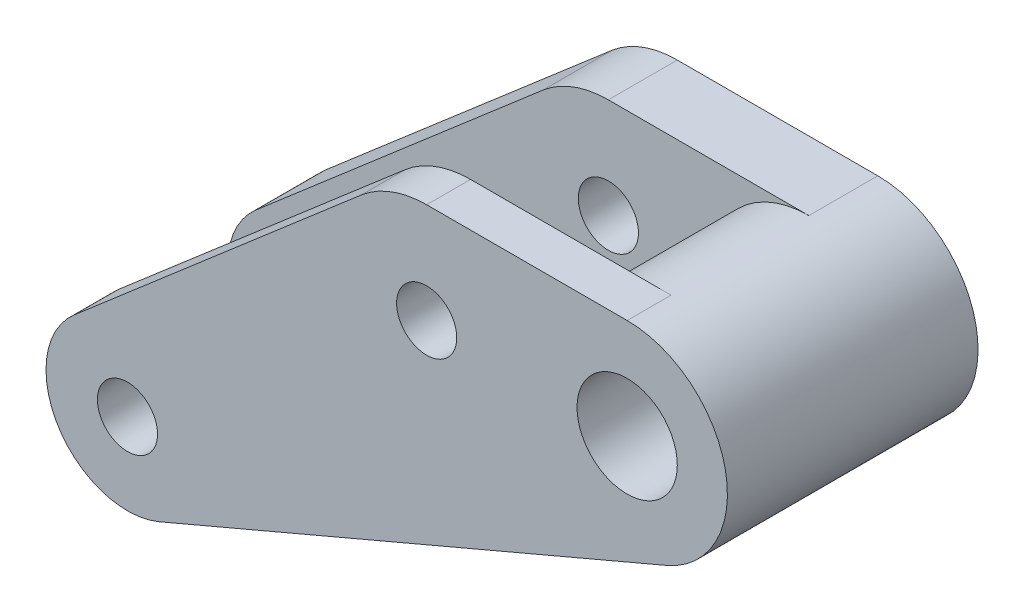
from build123d import *
from build123d.topology import SkipClean

# Parameters (mm, degrees)
SKETCH1_R           = 1.905
SKETCH1_R_2         = 3.175
BOSS_EXTRUDE1_DEPTH = 15.875
CUT_EXTRUDE2_DEPTH  = 4.365625


with BuildPart() as part:
    # Sketch1 → Boss-Extrude1 (new body)
    with BuildSketch(Plane.XY):
        with BuildLine():
            Line((-29.633029251, -19.50753994), (2.485871029, -5.843196491))
            ThreePointArc((2.485871029, -5.843196491), (6.22200923, 1.268503505), (0, 6.35))
            Line((0, 6.35), (-12.7, 6.35))
            ThreePointArc((-12.7, 6.35), (-14.910911787, 5.952677471), (-16.845147964, 4.810431203))
            Line((-16.845147964, 4.810431203), (-35.020732183, -10.851467439))
            ThreePointArc((-35.020732183, -10.851467439), (-36.033014448, -17.486271287), (-29.633029251, -19.50753994))
        make_face()
        with Locations((-12.7, 0)):
            Circle(SKETCH1_R, mode=Mode.SUBTRACT)
        with Locations((-31.652799462, -14.759942791)):
            Circle(SKETCH1_R, mode=Mode.SUBTRACT)
        Circle(SKETCH1_R_2, mode=Mode.SUBTRACT)
    extrude(amount=-BOSS_EXTRUDE1_DEPTH)

    # Sketch4 → Cut-Extrude2 (cut, symmetric)
    with SkipClean():  # the faces are left unmerged after this step: merging them gives an invalid solid
        with BuildSketch(Plane.XY.offset(-7.14375)):
            with BuildLine():
                Line((0, 6.35), (-12.7, 6.35))
                ThreePointArc((-12.7, 6.35), (-14.910911787, 5.952677471), (-16.845147964, 4.810431203))
                Line((-16.845147964, 4.810431203), (-35.020732183, -10.851467439))
                ThreePointArc((-35.020732183, -10.851467439), (-36.033014448, -17.486271287), (-29.633029251, -19.50753994))
                ThreePointArc((-29.633029251, -19.50753994), (-28.131062442, -18.530422701), (-27.053869093, -17.098529939))
                Line((-27.053869093, -17.098529939), (-20.285757113, -3.788751957))
                Line((-20.285757113, -3.788751957), (-15.073987601, -5.889540124))
                ThreePointArc((-15.073987601, -5.889540124), (-9.146995726, -5.262951703), (-6.35, 0))
                ThreePointArc((-6.35, 0), (-4.490128061, 4.490128061), (0, 6.35))
            make_face()
        extrude(amount=CUT_EXTRUDE2_DEPTH, both=True, mode=Mode.SUBTRACT)


solid = part.part
